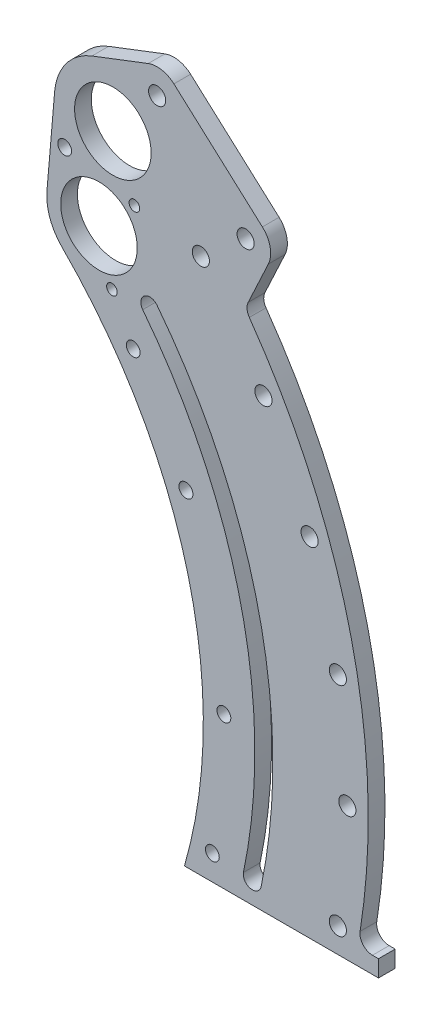
from build123d import *

# Parameters (mm, degrees)
SKETCH1_R           = 2.6289
SKETCH1_R_2         = 3.2639
SKETCH1_R_3         = 2.667
BOSS_EXTRUDE1_DEPTH = 6.35
BOSS_EXTRUDE2_START = -6.35
SKETCH3_R           = 14.5542
SKETCH3_R_2         = 3.2639
SKETCH3_R_3         = 2.6289
BOSS_EXTRUDE2_DEPTH = 6.35
SKETCH4_R           = 14.5542
SKETCH4_R_2         = 2.0193
CUT_EXTRUDE1_DEPTH  = 322.716169041
BOSS_EXTRUDE3_START = -6.35
BOSS_EXTRUDE3_DEPTH = 6.35
FILLET1_R           = 4.7625
FILLET2_R           = 4.7625


with BuildPart() as part:
    # Sketch1 → Boss-Extrude1 (new body)
    with BuildSketch(Plane.XY):
        with BuildLine():
            ThreePointArc((183.35625, 0), (181.552952325, -25.652288715), (176.178529946, -50.8))
            Line((176.178529946, -50.8), (240.761529124, -50.8))
            ThreePointArc((240.761529124, -50.8), (235.877364624, 70.061564101), (173.992462346, 173.992462346))
            Line((173.992462346, 173.992462346), (129.652447748, 129.652447748))
            ThreePointArc((129.652447748, 129.652447748), (169.399086533, 70.167399096), (183.35625, 0))
        make_face()
        with Locations((186.787775735, -41.275)):
            Circle(SKETCH1_R, mode=Mode.SUBTRACT)
        with BuildLine():
            ThreePointArc((198.61336608, -41.711026485), (201.859935486, -20.967721902), (202.946, 0))
            ThreePointArc((202.946, 0), (191.993196693, 65.769988136), (160.317011605, 124.440888401))
            ThreePointArc((160.317011605, 124.440888401), (160.923178893, 129.252192093), (165.734482585, 128.646024805))
            ThreePointArc((165.734482585, 128.646024805), (198.481076932, 67.99250338), (209.804, 0))
            ThreePointArc((209.804, 0), (208.692287116, -21.569601625), (205.368929989, -42.910616532))
            ThreePointArc((205.368929989, -42.910616532), (201.391341659, -45.688667392), (198.61336608, -41.711026485))
        make_face(mode=Mode.SUBTRACT)
        with Locations((234.507346186, -41.349972307)):
            Circle(SKETCH1_R_2, mode=Mode.SUBTRACT)
        with Locations((238.125, 0)):
            Circle(SKETCH1_R_2, mode=Mode.SUBTRACT)
        with Locations((191.177219016, 6.676055597)):
            Circle(SKETCH1_R, mode=Mode.SUBTRACT)
        with Locations((234.507346186, 41.349972307)):
            Circle(SKETCH1_R_2, mode=Mode.SUBTRACT)
        with Locations((156.698666372, 109.721587421)):
            Circle(SKETCH1_R, mode=Mode.SUBTRACT)
        with Locations((176.732380322, 73.20494884)):
            Circle(SKETCH1_R_3, mode=Mode.SUBTRACT)
        with Locations((182.414333018, 153.063799557)):
            Circle(SKETCH1_R_2, mode=Mode.SUBTRACT)
        with Locations((223.764305325, 81.443546629)):
            Circle(SKETCH1_R_2, mode=Mode.SUBTRACT)
        with Locations((206.222299276, 119.0625)):
            Circle(SKETCH1_R_2, mode=Mode.SUBTRACT)
    extrude(amount=BOSS_EXTRUDE1_DEPTH)

    # Sketch3 → Boss-Extrude2 (add)
    with BuildSketch(Plane.XY.offset(6.35).offset(BOSS_EXTRUDE2_START)):
        with BuildLine():
            Line((129.652447748, 129.652447748), (161.644610179, 161.644610179))
            Line((161.644610179, 161.644610179), (173.992462346, 173.992462346))
            ThreePointArc((173.992462346, 173.992462346), (187.203995727, 159.691633751), (199.243521921, 144.391041546))
            Line((199.243521921, 144.391041546), (208.072252438, 163.324315239))
            ThreePointArc((208.072252438, 163.324315239), (208.773335867, 169.249312232), (205.812262342, 174.428998606))
            Line((205.812262342, 174.428998606), (172.171515343, 204.711713553))
            ThreePointArc((172.171515343, 204.711713553), (167.533866317, 206.998129776), (162.384955615, 206.524625586))
            Line((162.384955615, 206.524625586), (140.998030433, 198.31353733))
            ThreePointArc((140.998030433, 198.31353733), (131.199359749, 190.920685757), (126.819367879, 179.454044017))
            Line((126.819367879, 179.454044017), (123.912144148, 145.370590574))
            ThreePointArc((123.912144148, 145.370590574), (125.044465056, 136.876859135), (129.652447748, 129.652447748))
        make_face()
        with Locations((148.963956123, 177.565172264)):
            Circle(SKETCH3_R, mode=Mode.SUBTRACT)
        with Locations((199.439670766, 167.349754182)):
            Circle(SKETCH3_R_2, mode=Mode.SUBTRACT)
        with Locations((165.798923767, 197.632469129)):
            Circle(SKETCH3_R_2, mode=Mode.SUBTRACT)
        with Locations((130.638344472, 163.06901389)):
            Circle(SKETCH3_R_3, mode=Mode.SUBTRACT)
    extrude(amount=BOSS_EXTRUDE2_DEPTH)

    # Sketch4 → Cut-Extrude1 (cut, through all)
    with BuildSketch(Plane.XY.offset(6.35)):
        with Locations((143.684097937, 143.684097937)):
            Circle(SKETCH4_R)
        with Locations((157.154482119, 157.154482119)):
            Circle(SKETCH4_R_2)
        with Locations((148.614600746, 125.283210946)):
            Circle(SKETCH4_R_2)
    extrude(amount=-CUT_EXTRUDE1_DEPTH, mode=Mode.SUBTRACT)

    # Sketch5 → Boss-Extrude3 (add)
    with BuildSketch(Plane.XY.offset(6.35).offset(BOSS_EXTRUDE3_START)):
        with BuildLine():
            Line((240.761529124, -50.8), (249.951861983, -50.8))
            Line((249.951861983, -50.8), (249.951861983, -44.45))
            Line((249.951861983, -44.45), (242.014361983, -44.45))
            ThreePointArc((242.014361983, -44.45), (241.408825198, -47.629119481), (240.761529124, -50.8))
        make_face()
    extrude(amount=BOSS_EXTRUDE3_DEPTH)

    # Fillet1
    fillet1_edges = [part.edges().sort_by_distance(p)[0] for p in [
        (242.014361983, -44.45, 3.175),
    ]]
    fillet(fillet1_edges, radius=FILLET1_R)

    # Fillet2
    fillet2_edges = [part.edges().sort_by_distance(p)[0] for p in [
        (199.243521921, 144.391041546, 3.175),
    ]]
    fillet(fillet2_edges, radius=FILLET2_R)


solid = part.part
